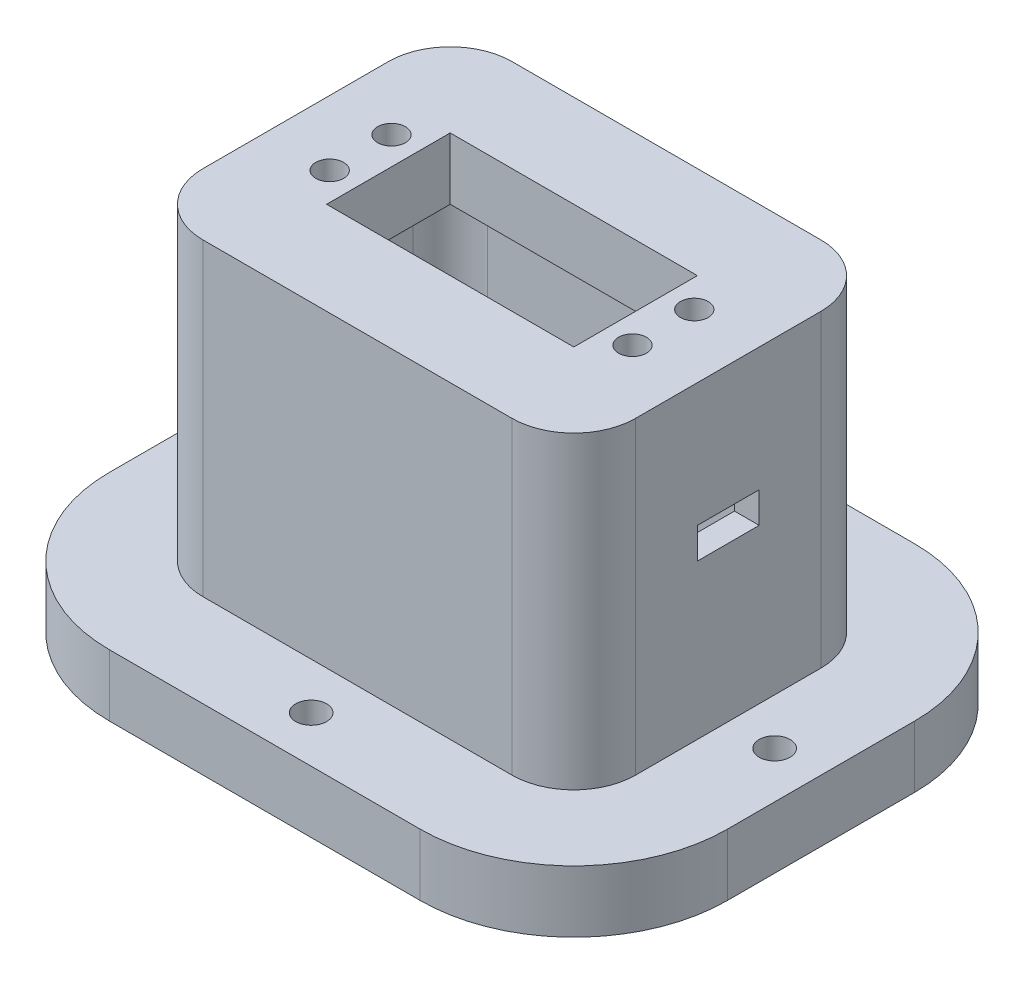
from build123d import *

# Parameters (mm, degrees)
CROQUIS1_W              = 70
CROQUIS1_H              = 50
CROQUIS1_W_2            = 40
CROQUIS1_H_2            = 20
SALIENTE_EXTRUIR1_DEPTH = 10
CROQUIS2_R              = 2.25
CORTAR_EXTRUIR1_DEPTH   = 10
REDONDEO3_R             = 10
SALIENTE_EXTRUIR2_DEPTH = 40
SALIENTE_EXTRUIR3_DEPTH = 10
CROQUIS5_R              = 2.5
CORTAR_EXTRUIR2_DEPTH   = 10
CROQUIS6_W              = 10
CROQUIS6_H              = 5
CORTAR_EXTRUIR3_DEPTH   = 15


with BuildPart() as part:
    # Croquis1 → Saliente-Extruir1 (new body)
    with BuildSketch(Plane(origin=(0, 0, 0), x_dir=(1, 0, 0), z_dir=(0, 1, 0))):
        Rectangle(CROQUIS1_W, CROQUIS1_H)
        Rectangle(CROQUIS1_W_2, CROQUIS1_H_2, mode=Mode.SUBTRACT)
    extrude(amount=SALIENTE_EXTRUIR1_DEPTH)

    # Croquis2 → Cortar-Extruir1 (cut)
    with BuildSketch(Plane(origin=(0, 10, 0), x_dir=(1, 0, 0), z_dir=(0, 1, 0))):
        with Locations((24.5, -5)):
            Circle(CROQUIS2_R)
        with Locations((24.5, 5)):
            Circle(CROQUIS2_R)
        with Locations((-24.5, -5)):
            Circle(CROQUIS2_R)
        with Locations((-24.5, 5)):
            Circle(CROQUIS2_R)
    extrude(amount=-CORTAR_EXTRUIR1_DEPTH, mode=Mode.SUBTRACT)

    # Redondeo3
    redondeo3_edges = [part.edges().sort_by_distance(p)[0] for p in [
        (35, 5, 25),
        (-35, 5, 25),
        (-35, 5, -25),
        (35, 5, -25),
    ]]
    fillet(redondeo3_edges, radius=REDONDEO3_R)

    # Croquis3 → Saliente-Extruir2 (add)
    with BuildSketch(Plane.XZ):
        with BuildLine():
            Line((-25, 25), (25, 25))
            ThreePointArc((25, 25), (32.071067812, 22.071067812), (35, 15))
            Line((35, 15), (35, -15))
            ThreePointArc((35, -15), (32.071067812, -22.071067812), (25, -25))
            Line((25, -25), (-25, -25))
            ThreePointArc((-25, -25), (-32.071067812, -22.071067812), (-35, -15))
            Line((-35, -15), (-35, 15))
            ThreePointArc((-35, 15), (-32.071067812, 22.071067812), (-25, 25))
        make_face()
        with BuildLine():
            Line((-25, 21), (25, 21))
            ThreePointArc((25, 21), (29.242640687, 19.242640687), (31, 15))
            Line((31, 15), (31, -15))
            ThreePointArc((31, -15), (29.242640687, -19.242640687), (25, -21))
            Line((25, -21), (-25, -21))
            ThreePointArc((-25, -21), (-29.242640687, -19.242640687), (-31, -15))
            Line((-31, -15), (-31, 15))
            ThreePointArc((-31, 15), (-29.242640687, 19.242640687), (-25, 21))
        make_face(mode=Mode.SUBTRACT)
    extrude(amount=SALIENTE_EXTRUIR2_DEPTH)

    # Croquis6 → Cortar-Extruir3 (cut)
    with BuildSketch(Plane(origin=(35, 0, 0), x_dir=(0, 0, -1), z_dir=(1, 0, 0))):
        with Locations((0, -12.5)):
            Rectangle(CROQUIS6_W, CROQUIS6_H)
    extrude(amount=-CORTAR_EXTRUIR3_DEPTH, mode=Mode.SUBTRACT)


with BuildPart() as body_2:
    # Croquis4 → Saliente-Extruir3 (new body)
    with BuildSketch(Plane.XZ.offset(40)):
        with BuildLine():
            Line((-25.152646878, 40), (25.152646878, 40))
            ThreePointArc((25.152646878, 40), (42.722378765, 32.722378765), (50, 15.152646878))
            Line((50, 15.152646878), (50, -15.152646878))
            ThreePointArc((50, -15.152646878), (42.722378765, -32.722378765), (25.152646878, -40))
            Line((25.152646878, -40), (-25.152646878, -40))
            ThreePointArc((-25.152646878, -40), (-42.722378765, -32.722378765), (-50, -15.152646878))
            Line((-50, -15.152646878), (-50, 15.152646878))
            ThreePointArc((-50, 15.152646878), (-42.722378765, 32.722378765), (-25.152646878, 40))
        make_face()
        with BuildLine():
            Line((-25, 21), (25, 21))
            ThreePointArc((25, 21), (29.242640687, 19.242640687), (31, 15))
            Line((31, 15), (31, -15))
            ThreePointArc((31, -15), (29.242640687, -19.242640687), (25, -21))
            Line((25, -21), (-25, -21))
            ThreePointArc((-25, -21), (-29.242640687, -19.242640687), (-31, -15))
            Line((-31, -15), (-31, 15))
            ThreePointArc((-31, 15), (-29.242640687, 19.242640687), (-25, 21))
        make_face(mode=Mode.SUBTRACT)
    extrude(amount=SALIENTE_EXTRUIR3_DEPTH)

    # Croquis5 → Cortar-Extruir2 (cut)
    with BuildSketch(Plane(origin=(0, -40, 0), x_dir=(1, 0, 0), z_dir=(0, 1, 0))):
        with Locations((-42.5, 0)):
            Circle(CROQUIS5_R)
        with Locations((0, 32.5)):
            Circle(CROQUIS5_R)
        with Locations((0, -32.5)):
            Circle(CROQUIS5_R)
        with Locations((42.5, 0)):
            Circle(CROQUIS5_R)
    extrude(amount=-CORTAR_EXTRUIR2_DEPTH, mode=Mode.SUBTRACT)


solid = Compound([part.part, body_2.part])
